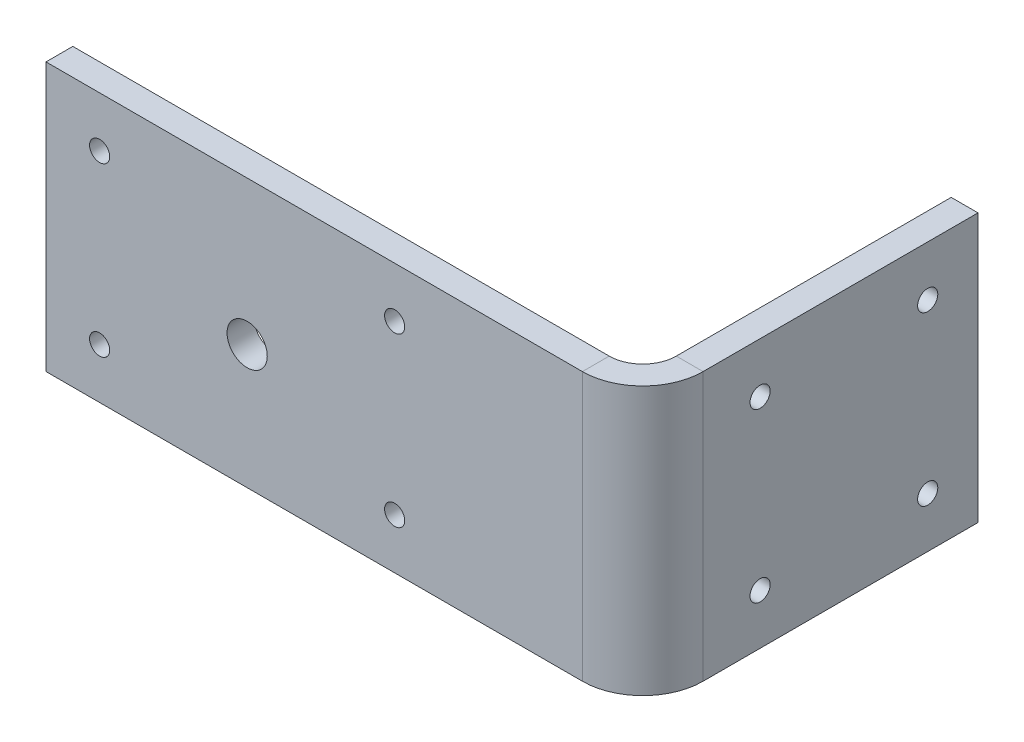
from build123d import *

# Parameters (mm, degrees)
SKETCH1_W           = 80
SKETCH1_H           = 40
SKETCH1_R           = 1.5
SKETCH1_R_2         = 3
BOSS_EXTRUDE1_DEPTH = 4
EDGE_FLANGE1_DEPTH  = 40
SKETCH13_R          = 1.5
CUT_EXTRUDE1_DEPTH  = 4


# Sheet-metal steps are written as plain solids
with BuildPart() as part:
    # Sketch1 → Boss-Extrude1 (new body)
    with BuildSketch(Plane.XY):
        with Locations((10, 0)):
            Rectangle(SKETCH1_W, SKETCH1_H)
        with Locations((22, 12.5)):
            Circle(SKETCH1_R, mode=Mode.SUBTRACT)
        with Locations((-22, 12.5)):
            Circle(SKETCH1_R, mode=Mode.SUBTRACT)
        with Locations((-22, -12.5)):
            Circle(SKETCH1_R, mode=Mode.SUBTRACT)
        with Locations((22, -12.5)):
            Circle(SKETCH1_R, mode=Mode.SUBTRACT)
        with Locations((0, -1.5)):
            Circle(SKETCH1_R_2, mode=Mode.SUBTRACT)
    extrude(amount=BOSS_EXTRUDE1_DEPTH)

    # Edge-Flange1 section (across the edge) → Edge-Flange1 (add)
    with BuildSketch(Plane(origin=(55, 20, 0), x_dir=(-1, 0, 0), z_dir=(0, -1, 0))):
        with BuildLine():
            Line((-4, 5), (-4, 46))
            Line((-4, 46), (0, 46))
            Line((0, 46), (0, 5))
            ThreePointArc((0, 5), (1.464466094, 1.464466094), (5, 0))
            Line((5, 0), (5, -4))
            ThreePointArc((5, -4), (-1.363961031, -1.363961031), (-4, 5))
        make_face()
    extrude(amount=EDGE_FLANGE1_DEPTH)

    # Sketch13 → Cut-Extrude1 (cut)
    with BuildSketch(Plane.ZY.offset(-55)):
        with Locations((-38.5, 12.5)):
            Circle(SKETCH13_R)
        with Locations((-13.5, 12.5)):
            Circle(SKETCH13_R)
        with Locations((-13.5, -12.5)):
            Circle(SKETCH13_R)
        with Locations((-38.5, -12.5)):
            Circle(SKETCH13_R)
    extrude(amount=-CUT_EXTRUDE1_DEPTH, mode=Mode.SUBTRACT)


solid = part.part
